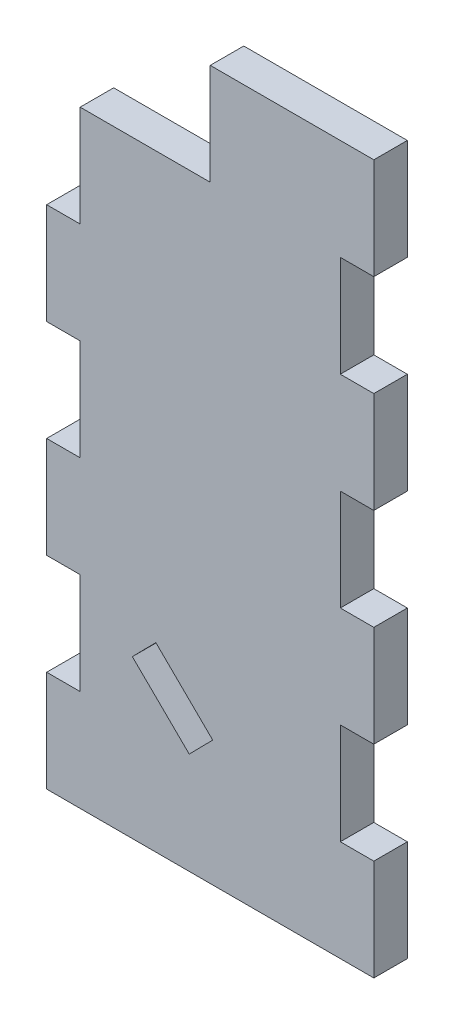
from build123d import *

# Parameters (mm, degrees)
SKETCH1_W           = 52.07
SKETCH1_H           = 112.776
BOSS_EXTRUDE1_DEPTH = 5.334
SKETCH2_W           = 5.334
SKETCH2_H           = 16.110857143
SKETCH2_H_2         = 16.110857142
CUT_EXTRUDE1_DEPTH  = 82.040197417
CUT_EXTRUDE2_DEPTH  = 82.040197417
SKETCH4_W           = 26.035
SKETCH4_H           = 16.110857143
CUT_EXTRUDE3_DEPTH  = 82.040197417


with BuildPart() as part:
    # Sketch1 → Boss-Extrude1 (new body)
    with BuildSketch(Plane.XY):
        with Locations((-13.887031982, -13.934780119)):
            Rectangle(SKETCH1_W, SKETCH1_H)
    extrude(amount=BOSS_EXTRUDE1_DEPTH)

    # Sketch2 → Cut-Extrude1 (cut, through all)
    with BuildSketch(Plane.XY.offset(5.334)):
        with Locations((-37.255031982, 18.286934167)):
            Rectangle(SKETCH2_W, SKETCH2_H)
        with Locations((-37.255031982, -13.93478012)):
            Rectangle(SKETCH2_W, SKETCH2_H)
        with Locations((-37.255031982, -46.156494405)):
            Rectangle(SKETCH2_W, SKETCH2_H_2)
        with Locations((9.480968018, -46.156494405)):
            Rectangle(SKETCH2_W, SKETCH2_H_2)
        with Locations((9.480968018, -13.93478012)):
            Rectangle(SKETCH2_W, SKETCH2_H)
        with Locations((9.480968018, 18.286934167)):
            Rectangle(SKETCH2_W, SKETCH2_H)
    extrude(amount=-CUT_EXTRUDE1_DEPTH, mode=Mode.SUBTRACT)

    # Sketch3 → Cut-Extrude2 (cut, through all)
    with BuildSketch(Plane.XY.offset(5.334)):
        Polygon((-22.544809753, -41.442678073), (-13.491049115, -50.348823048), (-17.231630005, -54.151402516), (-26.285390642, -45.245257541), align=None)
    extrude(amount=-CUT_EXTRUDE2_DEPTH, mode=Mode.SUBTRACT)

    # Sketch4 → Cut-Extrude3 (cut, through all)
    with BuildSketch(Plane.XY.offset(5.334)):
        with Locations((-26.904531982, 34.39779131)):
            Rectangle(SKETCH4_W, SKETCH4_H)
    extrude(amount=-CUT_EXTRUDE3_DEPTH, mode=Mode.SUBTRACT)


solid = part.part
